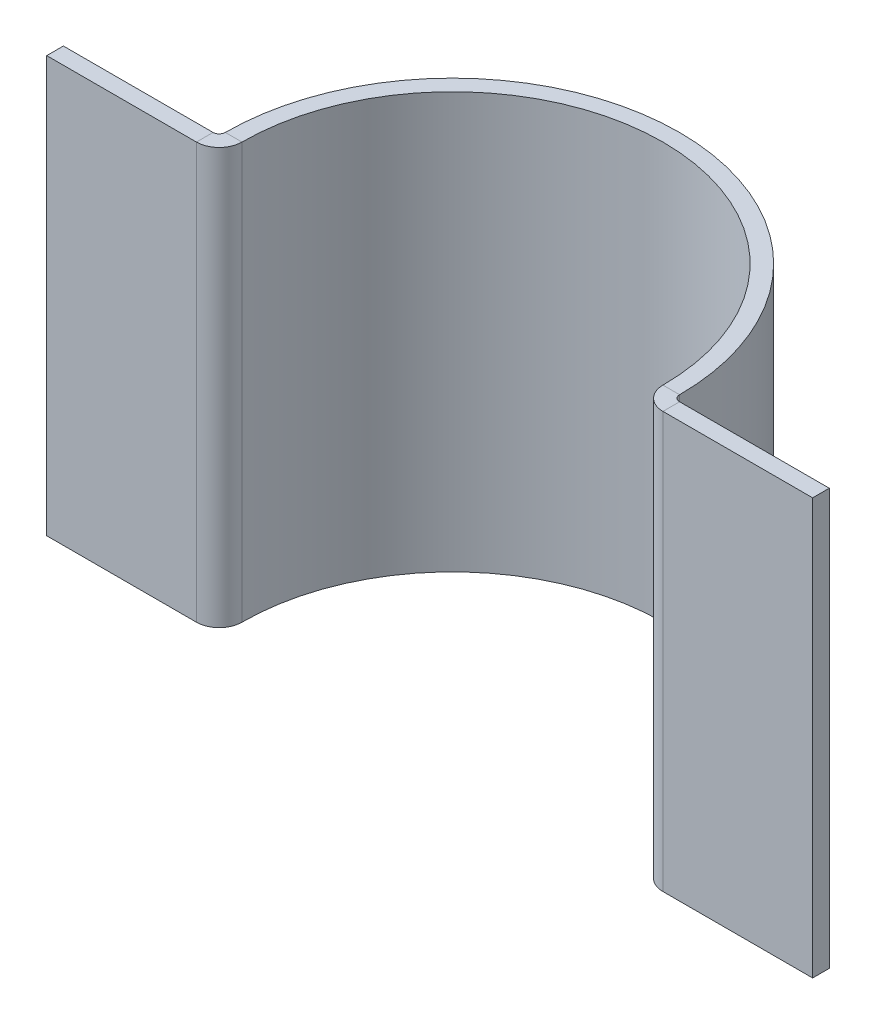
from build123d import *

# Parameters (mm, degrees)
BASE_FLANGE1_DEPTH      = 50
EDGE_FLANGE1_DEPTH      = 50
EDGE_FLANGE1_BEND_DEPTH = 50


# Sheet-metal steps are written as plain solids
with BuildPart() as part:
    # Sketch1 → Base-Flange1 (new body)
    with BuildSketch(Plane(origin=(0, 0, 0), x_dir=(1, 0, 0), z_dir=(0, 1, 0))):
        with BuildLine():
            ThreePointArc((25.308741749, 0), (0, 25.308741749), (-25.308741749, 0))
            Line((-25.308741749, 0), (-27.308741749, 0))
            ThreePointArc((-27.308741749, 0), (0, 27.308741749), (27.308741749, 0))
            Line((27.308741749, 0), (25.308741749, 0))
        make_face()
    extrude(amount=BASE_FLANGE1_DEPTH)

    # Edge-Flange1 section (across the edge) → Edge-Flange1 (add)
    with BuildSketch(Plane(origin=(27.308741749, 50, 0.7366), x_dir=(0, 0, -1), z_dir=(0, -1, 0))):
        with BuildLine():
            Line((-2, 0.7366), (-2, 18.7366))
            Line((-2, 18.7366), (0, 18.7366))
            Line((0, 18.7366), (0, 0.7366))
            ThreePointArc((0, 0.7366), (0.215745145, 0.215745145), (0.7366, 0))
            Line((0.7366, 0), (0.7366, -2))
            ThreePointArc((0.7366, -2), (-1.198468417, -1.198468417), (-2, 0.7366))
        make_face()
    extrude(amount=EDGE_FLANGE1_DEPTH)

    # Edge-Flange1 section 2 (across the edge) → Edge-Flange1 bend (add)
    with BuildSketch(Plane(origin=(-27.308741749, 0, 0.7366), x_dir=(0, 0, -1), z_dir=(0, 1, 0))):
        with BuildLine():
            Line((-2, 0.7366), (-2, 18.7366))
            Line((-2, 18.7366), (0, 18.7366))
            Line((0, 18.7366), (0, 0.7366))
            ThreePointArc((0, 0.7366), (0.215745145, 0.215745145), (0.7366, 0))
            Line((0.7366, 0), (0.7366, -2))
            ThreePointArc((0.7366, -2), (-1.198468417, -1.198468417), (-2, 0.7366))
        make_face()
    extrude(amount=EDGE_FLANGE1_BEND_DEPTH)


solid = part.part
